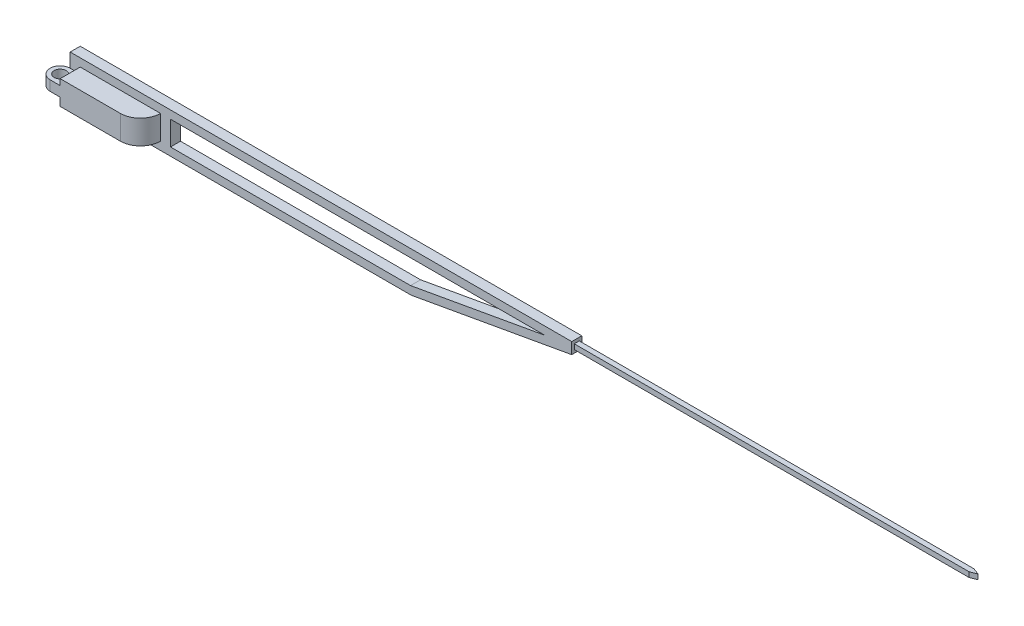
from build123d import *

# Parameters (mm, degrees)
BOSS_EXTRUDE1_DEPTH = 0.635
SKETCH4_W           = 0.635
SKETCH4_H           = 0.635
CUT_EXTRUDE2_DEPTH  = 115.335272335
SKETCH6_W           = 10.16
SKETCH6_H           = 3.048
BOSS_EXTRUDE2_DEPTH = 2.54
FILLET1_R           = 2.54
SKETCH9_W           = 2.54
SKETCH9_H           = 2.54
BOSS_EXTRUDE3_DEPTH = 0.635
CUT_EXTRUDE3_DEPTH  = 1.27
SKETCH11_R          = 0.762
CUT_EXTRUDE4_DEPTH  = 115.391755949
CUT_EXTRUDE5_DEPTH  = 0.508
CUT_EXTRUDE6_DEPTH  = 1.27


with BuildPart() as part:
    # Sketch1 → Boss-Extrude1 (new, symmetric)
    with BuildSketch(Plane.XY):
        Polygon((0, -2.54), (0, 2.54), (63.5, 2.54), (63.5, 1.100966908), (43.18, -2.54), align=None)
    extrude(amount=BOSS_EXTRUDE1_DEPTH, both=True)

    # Sweep1: sweep along a path in Sketch3
    with BuildLine(Plane.XY) as sweep1_path:
        Line((63.5, 1.820483454), (114.3, 1.820483454))
    # Sketch4 → Sweep1 (sweep)
    with BuildSketch(Plane(origin=(63.5, 0, 0), x_dir=(0, 0, -1), z_dir=(1, 0, 0))):
        with Locations((0, 1.820483454)):
            Rectangle(SKETCH4_W, SKETCH4_H)
    sweep(path=sweep1_path.line)

    # Sketch5 → Cut-Extrude2 (cut, through all)
    with BuildSketch(Plane.XY.offset(0.635)):
        Polygon((12.7, 1.524), (12.7, -1.524), (43.089694934, -1.524), (60.100385107, 1.524), align=None)
    extrude(amount=-CUT_EXTRUDE2_DEPTH, mode=Mode.SUBTRACT)

    # Sketch6 → Boss-Extrude2 (add)
    with BuildSketch(Plane.XY.offset(0.635)):
        with Locations((6.35, 0)):
            Rectangle(SKETCH6_W, SKETCH6_H)
    extrude(amount=BOSS_EXTRUDE2_DEPTH)

    # Fillet1
    fillet1_edges = [part.edges().sort_by_distance(p)[0] for p in [
        (11.43, 0, 3.175),
    ]]
    fillet(fillet1_edges, radius=FILLET1_R - 0.0001)  # a hair under: the kernel refuses the full size

    # Sketch9 → Boss-Extrude3 (add, symmetric)
    with BuildSketch(Plane(origin=(0, 0.127, 0), x_dir=(1, 0, 0), z_dir=(0, 1, 0))):
        with Locations((0, -1.905)):
            Rectangle(SKETCH9_W, SKETCH9_H)
    extrude(amount=BOSS_EXTRUDE3_DEPTH, both=True)

    # Sketch10 → Cut-Extrude3 (cut)
    with BuildSketch(Plane(origin=(0, 0.762, 0), x_dir=(1, 0, 0), z_dir=(0, 1, 0))):
        with BuildLine():
            ThreePointArc((-1.27, -1.905), (-0.898025612, -1.006974388), (0, -0.635))
            Line((0, -0.635), (-1.27, -0.635))
            Line((-1.27, -0.635), (-1.27, -1.905))
        make_face()
        with BuildLine():
            ThreePointArc((0, -3.175), (-0.898025612, -2.803025612), (-1.27, -1.905))
            Line((-1.27, -1.905), (-1.27, -3.175))
            Line((-1.27, -3.175), (0, -3.175))
        make_face()
    extrude(amount=-CUT_EXTRUDE3_DEPTH, mode=Mode.SUBTRACT)

    # Sketch11 → Cut-Extrude4 (cut, through all)
    with BuildSketch(Plane(origin=(0, 0.762, 0), x_dir=(1, 0, 0), z_dir=(0, 1, 0))):
        with Locations(Location((0, -1.905, 0), (0, 0, 180))):
            Circle(SKETCH11_R)
    extrude(amount=-CUT_EXTRUDE4_DEPTH, mode=Mode.SUBTRACT)

    # Sketch15 → Cut-Extrude5 (cut)
    # profile 1 of 4: a face of its own
    with BuildSketch(Plane(origin=(0, 0, -0.635), x_dir=(-1, 0, 0), z_dir=(0, 0, -1))):
        with BuildLine():
            Line((-11.943046291, -1.552792369), (-11.943046291, 1.622207631))
            Line((-11.943046291, 1.622207631), (-11.301940521, 1.622207631))
            add(Edge.make_bspline(
                [(-11.301940521, 1.622207631), (-11.246179368, 1.621806157), (-11.138449109, 1.621030511), (-10.982772103, 1.616112535), (-10.838732547, 1.607412612), (-10.706804168, 1.594740256), (-10.586624783, 1.579180004), (-10.478530903, 1.559676066), (-10.381963602, 1.536645369), (-10.322573466, 1.517009853), (-10.294488598, 1.507724458)],
                knots=[0, 0, 0, 0, 1.314313732, 2.53924729, 3.670748893, 4.714932338, 5.66265055, 6.526160246, 7.303039223, 8, 8, 8, 8], degree=3))
            add(Edge.make_bspline(
                [(-10.294488598, 1.507724458), (-10.257754085, 1.493726604), (-10.185118075, 1.46604832), (-10.081697328, 1.413836532), (-9.984337891, 1.354678933), (-9.892517667, 1.288497543), (-9.80833406, 1.213418455), (-9.728498325, 1.132630956), (-9.656276397, 1.043197248), (-9.590138157, 0.94697208), (-9.530506523, 0.845089004), (-9.478673145, 0.737742156), (-9.435625593, 0.625476688), (-9.399890309, 0.508604804), (-9.371726737, 0.386869518), (-9.352511699, 0.260129083), (-9.339838015, 0.12888439), (-9.33856434, 0.039826126), (-9.337918086, -0.005361479)],
                knots=[0, 0, 0, 0, 0.984719456, 1.947108742, 2.898477687, 3.838006223, 4.779231079, 5.722358779, 6.681677486, 7.655904652, 8.64651281, 9.637519902, 10.640069247, 11.656948941, 12.698408672, 13.768548281, 14.867775369, 16, 16, 16, 16], degree=3))
            add(Edge.make_bspline(
                [(-9.337918086, -0.005361479), (-9.338488649, -0.044605603), (-9.339613004, -0.121940247), (-9.349708883, -0.235914488), (-9.364383116, -0.346507514), (-9.387101781, -0.453192684), (-9.414681204, -0.55690471), (-9.450027256, -0.656538246), (-9.490518027, -0.753007273), (-9.537734703, -0.845007412), (-9.589570102, -0.932168757), (-9.645197683, -1.014333701), (-9.704558114, -1.090329795), (-9.768217438, -1.160387178), (-9.83535301, -1.224400239), (-9.906404367, -1.28290371), (-9.981554849, -1.33475287), (-10.060467861, -1.381985176), (-10.145445493, -1.423187927), (-10.238097314, -1.458049436), (-10.338818454, -1.486938865), (-10.447361687, -1.511042464), (-10.563914556, -1.530162588), (-10.688591332, -1.542977244), (-10.821200459, -1.551643119), (-10.912258792, -1.552401847), (-10.95912702, -1.552792369)],
                knots=[0, 0, 0, 0, 1.105936401, 2.179363191, 3.223086493, 4.248585256, 5.251745608, 6.245858792, 7.225916811, 8.198733463, 9.158002045, 10.082870192, 10.993790845, 11.873723703, 12.748670949, 13.606408763, 14.465103618, 15.319838547, 16.196477973, 17.123216899, 18.106603292, 19.147568657, 20.255746949, 21.433717677, 22.679120308, 24, 24, 24, 24], degree=3))
            Line((-10.95912702, -1.552792369), (-11.943046291, -1.552792369))
        make_face()
        with BuildLine():
            Line((-11.658110393, -1.227151343), (-11.293672292, -1.227151343))
            add(Edge.make_bspline(
                [(-11.293672292, -1.227151343), (-11.241304413, -1.226926284), (-11.140581803, -1.226493414), (-10.995749191, -1.222695022), (-10.863415739, -1.216488408), (-10.743562655, -1.207802444), (-10.636257612, -1.1963102), (-10.541276353, -1.183496896), (-10.458930226, -1.167533494), (-10.409101379, -1.153063695), (-10.386075137, -1.146377104)],
                knots=[0, 0, 0, 0, 1.375205317, 2.645023457, 3.804390687, 4.853969522, 5.800190428, 6.637939096, 7.370582563, 8, 8, 8, 8], degree=3))
            add(Edge.make_bspline(
                [(-10.386075137, -1.146377104), (-10.357093408, -1.136170334), (-10.299822179, -1.116000581), (-10.217380052, -1.079208988), (-10.140493341, -1.035627968), (-10.067822104, -0.987184476), (-10.000397209, -0.932169889), (-9.937419618, -0.871780492), (-9.879016127, -0.805708946), (-9.825790147, -0.734037256), (-9.778157614, -0.657211513), (-9.736908713, -0.575987), (-9.700757681, -0.491253679), (-9.672383529, -0.401710371), (-9.650144392, -0.308157582), (-9.634392139, -0.210588732), (-9.624581639, -0.10902204), (-9.623437326, -0.039941185), (-9.622853983, -0.004725462)],
                knots=[0, 0, 0, 0, 0.998632004, 1.973411704, 2.929992603, 3.868527914, 4.809262121, 5.754881198, 6.702106254, 7.672490631, 8.653608572, 9.636854334, 10.631411391, 11.644891563, 12.686317036, 13.754757253, 14.855430412, 16, 16, 16, 16], degree=3))
            add(Edge.make_bspline(
                [(-9.622853983, -0.004725462), (-9.623319608, 0.032407053), (-9.624234332, 0.105354206), (-9.635731742, 0.212388622), (-9.652533439, 0.315331784), (-9.676830069, 0.414190575), (-9.707791652, 0.509157866), (-9.746431077, 0.599708422), (-9.790578653, 0.686798553), (-9.843105251, 0.768418156), (-9.900632254, 0.845609762), (-9.964475044, 0.916326007), (-10.033619322, 0.980727979), (-10.107310936, 1.039818641), (-10.187626733, 1.09122069), (-10.272674724, 1.137200751), (-10.363702582, 1.17622231), (-10.427032671, 1.196976707), (-10.459217164, 1.207524138)],
                knots=[0, 0, 0, 0, 1.122418816, 2.205001699, 3.251619955, 4.274784885, 5.280384055, 6.268708349, 7.249350384, 8.229342522, 9.199999885, 10.157847722, 11.105861043, 12.055065948, 13.010012805, 13.98527497, 14.976112212, 16, 16, 16, 16], degree=3))
            add(Edge.make_bspline(
                [(-10.459217164, 1.207524138), (-10.485842847, 1.214886897), (-10.542456354, 1.230542144), (-10.634839296, 1.247619446), (-10.73881161, 1.262682099), (-10.854834911, 1.275434749), (-10.982776941, 1.284585391), (-11.122736101, 1.291453655), (-11.274772885, 1.2960861), (-11.380167041, 1.296402427), (-11.434868206, 1.296566606)],
                knots=[0, 0, 0, 0, 0.674548936, 1.434276114, 2.292660221, 3.240891867, 4.284742987, 5.42552168, 6.663806718, 8, 8, 8, 8], degree=3))
            Line((-11.434868206, 1.296566606), (-11.658110393, 1.296566606))
            Line((-11.658110393, 1.296566606), (-11.658110393, -1.227151343))
        make_face(mode=Mode.SUBTRACT)
    # profile 2 of 4: a face of its own
    with BuildSketch(Plane(origin=(0, 0, -0.635), x_dir=(-1, 0, 0), z_dir=(0, 0, -1))):
        with BuildLine():
            Line((-6.407148855, 0.767399939), (-6.407148855, -1.552792369))
            Line((-6.407148855, -1.552792369), (-6.692084752, -1.552792369))
            Line((-6.692084752, -1.552792369), (-6.692084752, -1.151465245))
            add(Edge.make_bspline(
                [(-6.692084752, -1.151465245), (-6.724214655, -1.187786877), (-6.786916565, -1.258668998), (-6.89163815, -1.351272112), (-7.002643569, -1.427815303), (-7.119394053, -1.489637012), (-7.241784174, -1.536075521), (-7.369542624, -1.569082965), (-7.50272152, -1.590304516), (-7.593664727, -1.592423621), (-7.639751018, -1.593497497)],
                knots=[0, 0, 0, 0, 1.074387032, 2.096679803, 3.090159297, 4.057316773, 5.018401886, 5.985159533, 6.978961417, 8, 8, 8, 8], degree=3))
            add(Edge.make_bspline(
                [(-7.639751018, -1.593497497), (-7.680724805, -1.592385002), (-7.761526926, -1.590191113), (-7.880389018, -1.573171023), (-7.994772701, -1.545838245), (-8.104786064, -1.507828152), (-8.209717224, -1.457408407), (-8.310464598, -1.397045989), (-8.406506254, -1.325163236), (-8.496378293, -1.242986953), (-8.57913875, -1.153728644), (-8.651765762, -1.05852804), (-8.712320341, -0.957796808), (-8.762957129, -0.852810304), (-8.801960956, -0.742760341), (-8.829151324, -0.628027481), (-8.846151586, -0.508747382), (-8.848344569, -0.427522243), (-8.849456547, -0.386336039)],
                knots=[0, 0, 0, 0, 1.033919861, 2.038935746, 3.024066025, 3.998881131, 4.97069526, 5.957263378, 6.95902576, 7.993208707, 9.027059324, 10.027763471, 11.009749337, 11.988697705, 12.965288445, 13.950418724, 14.960734635, 16, 16, 16, 16], degree=3))
            add(Edge.make_bspline(
                [(-8.849456547, -0.386336039), (-8.848319923, -0.346001108), (-8.846072879, -0.266261125), (-8.829333172, -0.148986877), (-8.801183614, -0.036031026), (-8.761679495, 0.072242772), (-8.711022865, 0.175965532), (-8.649402386, 0.275210612), (-8.576813608, 0.370251422), (-8.493127496, 0.458853178), (-8.402472383, 0.540696164), (-8.305490892, 0.611824369), (-8.204595486, 0.673253225), (-8.098221184, 0.721924593), (-7.987942453, 0.761302852), (-7.872777542, 0.788547044), (-7.75320561, 0.804601043), (-7.672024949, 0.806925836), (-7.630846771, 0.808105067)],
                knots=[0, 0, 0, 0, 1.020392517, 2.01726096, 2.990465484, 3.961182959, 4.928053699, 5.906110375, 6.912531644, 7.948652711, 8.985773172, 9.998621852, 10.987621588, 11.969261332, 12.953316658, 13.946091881, 14.958173133, 16, 16, 16, 16], degree=3))
            add(Edge.make_bspline(
                [(-7.630846771, 0.808105067), (-7.583494042, 0.806800821), (-7.490637575, 0.804243256), (-7.354812881, 0.782959211), (-7.226321104, 0.747001458), (-7.104170371, 0.698090585), (-6.98879932, 0.633094952), (-6.881300184, 0.551107416), (-6.780547924, 0.452645054), (-6.722145802, 0.377016151), (-6.692084752, 0.33808804)],
                knots=[0, 0, 0, 0, 1.038897134, 2.037228247, 3.008116434, 3.962042015, 4.918381754, 5.904844433, 6.921570401, 8, 8, 8, 8], degree=3))
            Line((-6.692084752, 0.33808804), (-6.692084752, 0.767399939))
            Line((-6.692084752, 0.767399939), (-6.407148855, 0.767399939))
        make_face()
        with BuildLine():
            add(Edge.make_bspline(
                [(-7.627030666, 0.52316917), (-7.668681529, 0.521687227), (-7.750893709, 0.518762108), (-7.871583625, 0.495926151), (-7.98707508, 0.457930841), (-8.096790447, 0.405967973), (-8.198996615, 0.340627619), (-8.290340159, 0.261596079), (-8.371568181, 0.171029644), (-8.439883535, 0.069337016), (-8.495573486, -0.039681681), (-8.534732151, -0.153640993), (-8.560557825, -0.270485508), (-8.563196269, -0.349735945), (-8.56452065, -0.389516127)],
                knots=[0, 0, 0, 0, 1.031046209, 2.035121221, 3.029706178, 4.034933723, 5.034054252, 6.02443088, 7.017295772, 8.038157696, 9.050218397, 10.03989886, 11.016116709, 12, 12, 12, 12], degree=3))
            add(Edge.make_bspline(
                [(-8.56452065, -0.389516127), (-8.562828925, -0.429058581), (-8.559452107, -0.507988497), (-8.535185405, -0.624992306), (-8.494472949, -0.738978472), (-8.438917649, -0.848979517), (-8.369351925, -0.951109379), (-8.288717219, -1.043402205), (-8.196233749, -1.12276776), (-8.093792368, -1.189204701), (-7.984383709, -1.24287356), (-7.869327214, -1.280216675), (-7.750785742, -1.304326519), (-7.670183982, -1.307142723), (-7.629574736, -1.3085616)],
                knots=[0, 0, 0, 0, 0.979072187, 1.954306742, 2.945804271, 3.96968567, 4.997920485, 5.998718438, 6.996577872, 8.005894225, 9.015743152, 10.005417472, 10.995077863, 12, 12, 12, 12], degree=3))
            add(Edge.make_bspline(
                [(-7.629574736, -1.3085616), (-7.588348266, -1.307055775), (-7.506352905, -1.30406084), (-7.385304934, -1.28112712), (-7.267834504, -1.243236853), (-7.155541804, -1.190714074), (-7.050933599, -1.125619901), (-6.957046239, -1.049413469), (-6.877656753, -0.960782723), (-6.810353457, -0.863376941), (-6.757580044, -0.756595344), (-6.719138904, -0.642899328), (-6.696411433, -0.522284935), (-6.693546921, -0.439858373), (-6.692084752, -0.397784356)],
                knots=[0, 0, 0, 0, 1.01762866, 2.023962475, 3.030623092, 4.058876274, 5.077231937, 6.066672613, 7.034107872, 8.005628644, 8.981990164, 9.965428785, 10.961468474, 12, 12, 12, 12], degree=3))
            add(Edge.make_bspline(
                [(-6.692084752, -0.397784356), (-6.692955298, -0.365727895), (-6.694668807, -0.302630637), (-6.707759395, -0.209986388), (-6.728582792, -0.121327937), (-6.757925389, -0.036562069), (-6.796471054, 0.043842552), (-6.842960099, 0.120463249), (-6.898210043, 0.192901519), (-6.961331489, 0.260159876), (-7.030424208, 0.321506739), (-7.10353497, 0.376265728), (-7.181529976, 0.421249829), (-7.263097574, 0.458480126), (-7.348379284, 0.48810664), (-7.438069061, 0.507871191), (-7.53121357, 0.521442339), (-7.594755349, 0.522587499), (-7.627030666, 0.52316917)],
                knots=[0, 0, 0, 0, 1.050140795, 2.067009409, 3.05949893, 4.030605086, 5.00011959, 5.97591094, 6.962425594, 7.979863591, 8.993523472, 9.986985069, 10.967611495, 11.937549037, 12.921786183, 13.919465291, 14.943216303, 16, 16, 16, 16], degree=3))
        make_face(mode=Mode.SUBTRACT)
    # profile 3 of 4: a face of its own
    with BuildSketch(Plane(origin=(0, 0, -0.635), x_dir=(-1, 0, 0), z_dir=(0, 0, -1))):
        Polygon((-6.000097573, 0.767399939), (-5.691629023, 0.767399939), (-4.921411675, -0.921862882), (-4.151194328, 0.767399939), (-3.842725778, 0.767399939), (-4.901059111, -1.552792369), (-4.941764239, -1.552792369), align=None)
    # profile 4 of 4: a face of its own
    with BuildSketch(Plane(origin=(0, 0, -0.635), x_dir=(-1, 0, 0), z_dir=(0, 0, -1))):
        with BuildLine():
            Line((-1.450027461, -0.820100061), (-1.196892445, -0.953027745))
            add(Edge.make_bspline(
                [(-1.196892445, -0.953027745), (-1.217064213, -0.988808482), (-1.256310486, -1.058423625), (-1.323802593, -1.154065384), (-1.394552545, -1.240105812), (-1.471754002, -1.314246284), (-1.55309721, -1.378881469), (-1.639033262, -1.435430781), (-1.730009546, -1.483616868), (-1.826030368, -1.524213804), (-1.927902104, -1.555428131), (-2.035871622, -1.577475531), (-2.150145764, -1.591103782), (-2.228474085, -1.592686874), (-2.268582148, -1.593497497)],
                knots=[0, 0, 0, 0, 1.120438281, 2.179929193, 3.190490725, 4.156257408, 5.095198341, 6.022838206, 6.959905092, 7.901321166, 8.864066838, 9.862729781, 10.905609505, 12, 12, 12, 12], degree=3))
            add(Edge.make_bspline(
                [(-2.268582148, -1.593497497), (-2.313160942, -1.592456845), (-2.400121254, -1.590426835), (-2.526703739, -1.572925813), (-2.64588364, -1.544375888), (-2.757654257, -1.504492861), (-2.861741872, -1.452398074), (-2.958353361, -1.38893483), (-3.047996788, -1.314429142), (-3.127847321, -1.228235654), (-3.199732843, -1.135995593), (-3.263165551, -1.039878469), (-3.316194792, -0.940126115), (-3.359331803, -0.837373568), (-3.394170502, -0.732268465), (-3.418451726, -0.623854491), (-3.432448712, -0.512425068), (-3.434593602, -0.437043913), (-3.435674496, -0.399056391)],
                knots=[0, 0, 0, 0, 1.145258523, 2.234067595, 3.276747158, 4.290159414, 5.277019952, 6.260822364, 7.254936242, 8.264827045, 9.274100331, 10.257902744, 11.220704747, 12.172965371, 13.118907548, 14.062713208, 15.023725156, 16, 16, 16, 16], degree=3))
            add(Edge.make_bspline(
                [(-3.435674496, -0.399056391), (-3.434713703, -0.363410366), (-3.432809539, -0.292764653), (-3.420807325, -0.188202337), (-3.399536374, -0.086576527), (-3.370347851, 0.012197222), (-3.332654935, 0.10795353), (-3.28654285, 0.200750673), (-3.231939765, 0.290489907), (-3.189782411, 0.347098464), (-3.168547092, 0.37561308)],
                knots=[0, 0, 0, 0, 1.024358464, 2.0301432, 3.019427413, 4.004406732, 4.986367066, 5.972626655, 6.978780325, 8, 8, 8, 8], degree=3))
            add(Edge.make_bspline(
                [(-3.168547092, 0.37561308), (-3.139783694, 0.409965555), (-3.08316805, 0.477582306), (-2.987413356, 0.566426358), (-2.883726749, 0.640851783), (-2.773407631, 0.702543971), (-2.65517383, 0.749419351), (-2.530614687, 0.784351229), (-2.398311905, 0.803925567), (-2.307865026, 0.806690388), (-2.261585954, 0.808105067)],
                knots=[0, 0, 0, 0, 1.030682036, 2.02871468, 2.997146059, 3.962720338, 4.930598197, 5.918074684, 6.934738563, 8, 8, 8, 8], degree=3))
            add(Edge.make_bspline(
                [(-2.261585954, 0.808105067), (-2.214008484, 0.806876751), (-2.120672332, 0.804467076), (-1.984571765, 0.782127473), (-1.855793115, 0.746701227), (-1.734387915, 0.69666886), (-1.620343855, 0.632116981), (-1.514402225, 0.552159739), (-1.41475121, 0.459251903), (-1.356776999, 0.38780242), (-1.327276058, 0.35144441)],
                knots=[0, 0, 0, 0, 1.056321875, 2.072262726, 3.055038591, 4.01806755, 4.982017516, 5.957941055, 6.960871419, 8, 8, 8, 8], degree=3))
            add(Edge.make_bspline(
                [(-1.327276058, 0.35144441), (-1.307203764, 0.324045447), (-1.267192783, 0.269429896), (-1.217075771, 0.180374633), (-1.173571563, 0.08720145), (-1.138798091, -0.011595748), (-1.110640829, -0.114846367), (-1.090269287, -0.223288532), (-1.078322561, -0.336889952), (-1.075974243, -0.414293327), (-1.07477706, -0.453753907)],
                knots=[0, 0, 0, 0, 0.94817472, 1.890038105, 2.849395472, 3.817997239, 4.812318967, 5.836947057, 6.897266129, 8, 8, 8, 8], degree=3))
            Line((-1.07477706, -0.453753907), (-3.150738598, -0.453753907))
            add(Edge.make_bspline(
                [(-3.150738598, -0.453753907), (-3.149341955, -0.484325043), (-3.146595513, -0.544441947), (-3.133791062, -0.632408301), (-3.113608246, -0.716204118), (-3.085242739, -0.795200878), (-3.050892101, -0.870430351), (-3.008813629, -0.941334484), (-2.958612748, -1.007590321), (-2.902618721, -1.06979051), (-2.84029157, -1.125181343), (-2.774720792, -1.174758312), (-2.704967344, -1.216310531), (-2.631581225, -1.250038003), (-2.554681106, -1.27644159), (-2.474242757, -1.294464541), (-2.390424466, -1.306535988), (-2.333287407, -1.307878256), (-2.304199135, -1.3085616)],
                knots=[0, 0, 0, 0, 1.094153842, 2.151609401, 3.174256925, 4.172055639, 5.149267565, 6.128595816, 7.11444997, 8.118368179, 9.117203808, 10.09244225, 11.054858984, 12.015122123, 12.976791628, 13.957293641, 14.960065497, 16, 16, 16, 16], degree=3))
            add(Edge.make_bspline(
                [(-2.304199135, -1.3085616), (-2.275759166, -1.308010005), (-2.21932881, -1.306915536), (-2.135290318, -1.296273017), (-2.052613747, -1.279064267), (-1.971641284, -1.255578348), (-1.894016302, -1.226933632), (-1.822129267, -1.192368897), (-1.7560165, -1.154133055), (-1.69422468, -1.110399993), (-1.634288851, -1.056871137), (-1.574832452, -0.990073019), (-1.511081488, -0.91107219), (-1.471176643, -0.851612907), (-1.450027461, -0.820100061)],
                knots=[0, 0, 0, 0, 0.99110716, 1.966546729, 2.947904876, 3.932708344, 4.903319531, 5.828989031, 6.710028674, 7.56322171, 8.463672341, 9.504779593, 10.677557249, 12, 12, 12, 12], degree=3))
        make_face()
        with BuildLine():
            add(Edge.make_bspline(
                [(-1.359712957, -0.16881801), (-1.370142038, -0.131023831), (-1.390214662, -0.058282204), (-1.432157649, 0.042447746), (-1.479393976, 0.131971771), (-1.535293689, 0.209604724), (-1.598629247, 0.278550768), (-1.671785949, 0.338801913), (-1.753824224, 0.392702029), (-1.844320015, 0.438197511), (-1.940152206, 0.476923311), (-2.040487823, 0.50289038), (-2.142865959, 0.520679037), (-2.212112062, 0.522335578), (-2.246957549, 0.52316917)],
                knots=[0, 0, 0, 0, 1.154881502, 2.222775134, 3.210006277, 4.132804581, 5.035138423, 5.962687519, 6.919655026, 7.923214229, 8.944639381, 9.960483929, 10.97369054, 12, 12, 12, 12], degree=3))
            add(Edge.make_bspline(
                [(-2.246957549, 0.52316917), (-2.275395968, 0.522614296), (-2.331612744, 0.521517428), (-2.414435856, 0.511112382), (-2.493973868, 0.493913094), (-2.570813665, 0.470359169), (-2.64394831, 0.438964223), (-2.714882135, 0.402149439), (-2.781811495, 0.357208145), (-2.823668241, 0.322955469), (-2.844814119, 0.305651141)],
                knots=[0, 0, 0, 0, 1.04873581, 2.073130211, 3.073294108, 4.04793562, 5.032784715, 6.005352987, 6.992311501, 8, 8, 8, 8], degree=3))
            add(Edge.make_bspline(
                [(-2.844814119, 0.305651141), (-2.859957311, 0.29195844), (-2.89060344, 0.264247751), (-2.931552341, 0.216505543), (-2.970759484, 0.165023768), (-3.006440726, 0.107832834), (-3.039168251, 0.045583984), (-3.069793373, -0.021197728), (-3.09735819, -0.093019067), (-3.112866804, -0.143068351), (-3.12084577, -0.16881801)],
                knots=[0, 0, 0, 0, 0.879870761, 1.780643979, 2.707998968, 3.669668524, 4.684282772, 5.740141944, 6.837334558, 8, 8, 8, 8], degree=3))
            Line((-3.12084577, -0.16881801), (-1.359712957, -0.16881801))
        make_face(mode=Mode.SUBTRACT)
    extrude(amount=-CUT_EXTRUDE5_DEPTH, mode=Mode.SUBTRACT)

    # Sketch16 → Cut-Extrude6 (cut)
    with BuildSketch(Plane(origin=(0, 2.137983454, 0), x_dir=(1, 0, 0), z_dir=(0, 1, 0))):
        Polygon((114.3, -0.3175), (114.3, 0), (113.469629751, -0.3175), align=None)
        Polygon((114.3, 0), (114.3, 0.3175), (113.469629751, 0.3175), align=None)
    extrude(amount=-CUT_EXTRUDE6_DEPTH, mode=Mode.SUBTRACT)


solid = part.part
